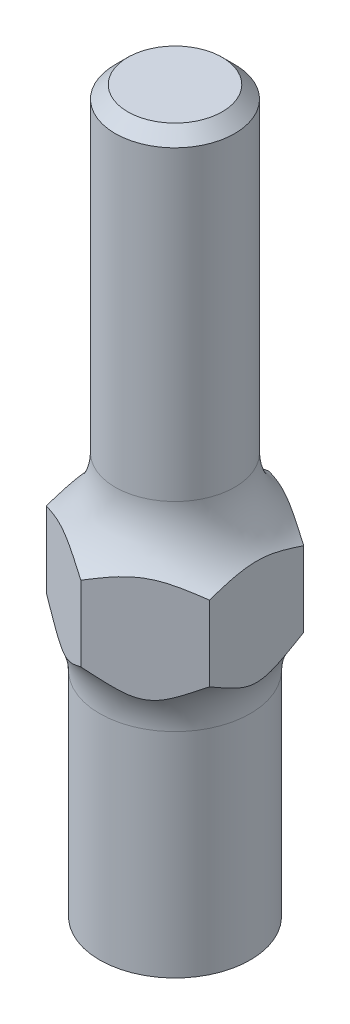
from build123d import *

# Parameters (mm, degrees)
SKETCH1_R                    = 4.7625
BOSS_EXTRUDE1_DEPTH          = 31.4
SKETCH3_R                    = 12.7
BOSS_EXTRUDE2_DEPTH          = 3
SKETCH4_R                    = 6
BOSS_EXTRUDE3_DEPTH          = 26
FILLET1_R                    = 6
F_5_16_24_TAPPED_HOLE1_D     = 6.9088
F_5_16_24_TAPPED_HOLE1_DEPTH = 20
F_5_16_24_TAPPED_HOLE1_TIP   = 2.075612922
CUT_EXTRUDE1_DEPTH           = 37.173747387
CUT_EXTRUDE1_DEPTH_BACK      = 37.173747387
SKETCH2_OUTSIDE_W            = 40.942
SKETCH2_OUTSIDE_H            = 40.942
CHAMFER1_SIZE                = 1


with BuildPart() as part:
    # Sketch1 → Boss-Extrude1 (new body)
    with BuildSketch(Plane(origin=(0, 0, 0), x_dir=(1, 0, 0), z_dir=(0, 1, 0))):
        Circle(SKETCH1_R)
    extrude(amount=BOSS_EXTRUDE1_DEPTH)

    # Sketch3 → Boss-Extrude2 (add)
    with BuildSketch(Plane(origin=(0, 0, 0), x_dir=(1, 0, 0), z_dir=(0, 1, 0))):
        Circle(SKETCH3_R)
    extrude(amount=-BOSS_EXTRUDE2_DEPTH)

    # Sketch4 → Boss-Extrude3 (add)
    with BuildSketch(Plane(origin=(0, 0, 0), x_dir=(1, 0, 0), z_dir=(0, 1, 0))):
        Circle(SKETCH4_R)
    extrude(amount=-BOSS_EXTRUDE3_DEPTH)

    # Fillet1
    fillet1_edges = [part.edges().sort_by_distance(p)[0] for p in [
        (-4.7625, 0, 0),
        (-6, -3, 0),
    ]]
    fillet(fillet1_edges, radius=FILLET1_R)

    # 5/16-24 Tapped Hole1
    with Locations(Plane(origin=(0, -26, 0), x_dir=(-1, 0, 0), z_dir=(0, -1, 0))):
        with Locations((0, 0)):
            Hole(F_5_16_24_TAPPED_HOLE1_D / 2, depth=F_5_16_24_TAPPED_HOLE1_DEPTH)
            with Locations((0, 0, -(F_5_16_24_TAPPED_HOLE1_DEPTH + F_5_16_24_TAPPED_HOLE1_TIP / 2))):  # 118° drill point
                Cone(0, F_5_16_24_TAPPED_HOLE1_D / 2, F_5_16_24_TAPPED_HOLE1_TIP, mode=Mode.SUBTRACT)

    # Sketch2 outside → Cut-Extrude1 (cut, two sides: drawn at the far end of the back side and taken through both)
    with BuildSketch(Plane(origin=(0, 0, 0), x_dir=(1, 0, 0), z_dir=(0, 1, 0)).offset(-CUT_EXTRUDE1_DEPTH_BACK)):
        Rectangle(SKETCH2_OUTSIDE_W, SKETCH2_OUTSIDE_H)
        Polygon((6.5, -3.75277675), (6.5, 3.75277675), (0, 7.505553499), (-6.5, 3.75277675), (-6.5, -3.75277675), (0, -7.505553499), align=None, mode=Mode.SUBTRACT)
    extrude(amount=CUT_EXTRUDE1_DEPTH + CUT_EXTRUDE1_DEPTH_BACK, mode=Mode.SUBTRACT)

    # Chamfer1
    chamfer1_edges = [part.edges().sort_by_distance(p)[0] for p in [
        (-4.7625, 31.4, 0),
    ]]
    chamfer(chamfer1_edges, length=CHAMFER1_SIZE)


solid = part.part
